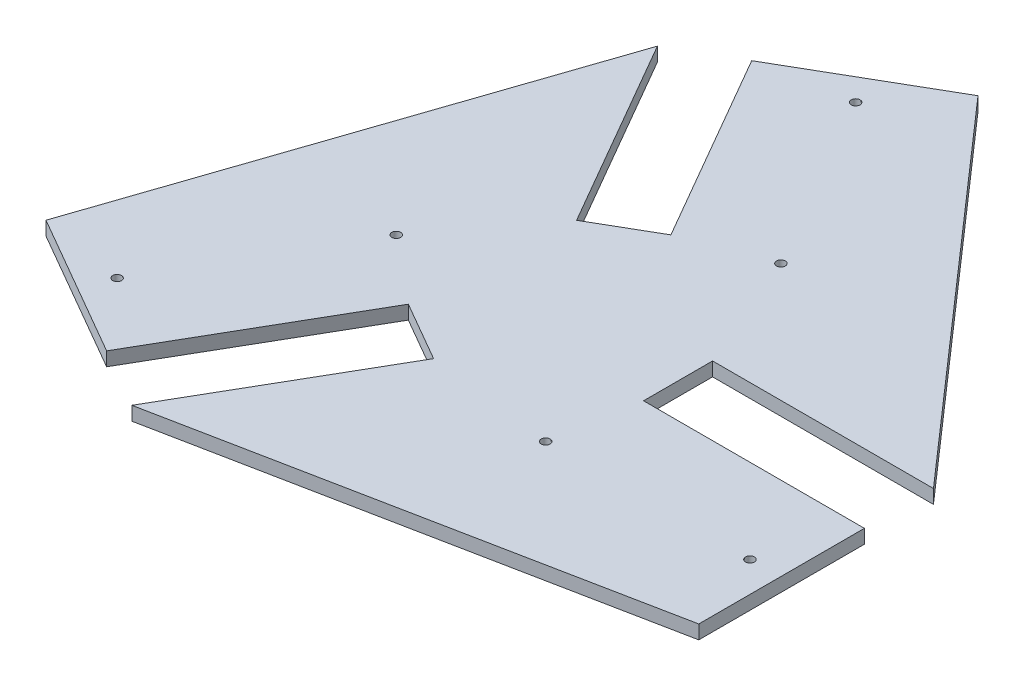
from build123d import *

# Parameters (mm, degrees)
SKETCH1_R           = 1.016
BOSS_EXTRUDE2_DEPTH = 3.175


with BuildPart() as part:
    # Sketch1 → Boss-Extrude2 (new body)
    with BuildSketch(Plane(origin=(0, 0, 0), x_dir=(1, 0, 0), z_dir=(0, 1, 0))):
        Polygon((76.2, -47.5615), (-32.545746073, -69.197885768), (-7.145746073, -25.203795256), (-20.893899358, -17.266295256), (-46.293899358, -61.260385768), (-79.289467242, -42.210385768), (-43.654253927, 62.784385768), (-18.254253927, 18.790295256), (-4.506100642, 26.727795256), (-29.906100642, 70.721885768), (3.089467242, 89.771885768), (76.2, 6.4135), (25.4, 6.4135), (25.4, -9.4615), (76.2, -9.4615), align=None)
        with Locations((69.2404, -28.829)):
            Circle(SKETCH1_R, mode=Mode.SUBTRACT)
        with Locations((-59.586846366, -45.549445368)):
            Circle(SKETCH1_R, mode=Mode.SUBTRACT)
        with Locations((-9.653553634, 74.378445368)):
            Circle(SKETCH1_R, mode=Mode.SUBTRACT)
        with Locations((22.2504, -28.829)):
            Circle(SKETCH1_R, mode=Mode.SUBTRACT)
        with Locations((-36.091846366, -4.854911644)):
            Circle(SKETCH1_R, mode=Mode.SUBTRACT)
        with Locations((13.841446366, 33.683911644)):
            Circle(SKETCH1_R, mode=Mode.SUBTRACT)
    extrude(amount=BOSS_EXTRUDE2_DEPTH)


solid = part.part
